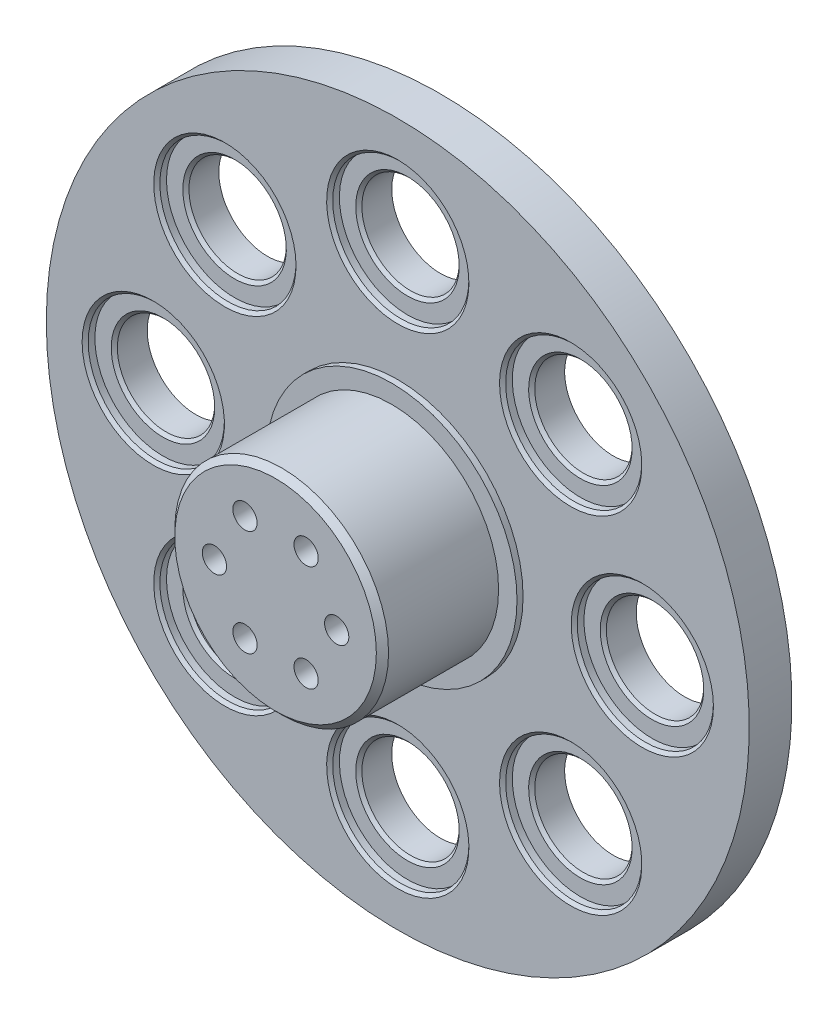
from build123d import *

# Parameters (mm, degrees)
SKETCH1_R                    = 17.49
BOSS_EXTRUDE1_DEPTH          = 19
SKETCH7_R                    = 20.5
BOSS_EXTRUDE3_DEPTH          = 0.995
SKETCH3_R                    = 57.5
BOSS_EXTRUDE2_DEPTH          = 6.975
SKETCH4_R                    = 11.015
CUT_EXTRUDE1_DEPTH           = 7
SKETCH5_R                    = 7.5
CUT_EXTRUDE2_DEPTH           = 0.5
SKETCH6_R                    = 1.985
CUT_EXTRUDE3_DEPTH           = 10
CIRPATTERN1_COUNT            = 6
CHAMFER1_SIZE                = 1
SKETCH8_R                    = 7.965
CUT_EXTRUDE4_DEPTH           = 84.7394771
SKETCH9_R                    = 11.1375
CUT_EXTRUDE5_DEPTH           = 1.5875
CHAMFER2_SIZE                = 0.5
CHAMFER3_SIZE                = 0.5
CIRPATTERN2_COUNT            = 8
CHAMFER2_OF_CIRPATTERN2_SIZE = 0.5
CHAMFER3_OF_CIRPATTERN2_SIZE = 0.5


with BuildPart() as part:
    # Sketch1 → Boss-Extrude1 (new body)
    with BuildSketch(Plane.XY):
        Circle(SKETCH1_R)
    extrude(amount=BOSS_EXTRUDE1_DEPTH)

    # Sketch7 → Boss-Extrude3 (add)
    with BuildSketch(Plane(origin=(0, 0, 0), x_dir=(-1, 0, 0), z_dir=(0, 0, -1))):
        Circle(SKETCH7_R)
    extrude(amount=BOSS_EXTRUDE3_DEPTH)

    # Sketch3 → Boss-Extrude2 (add)
    with BuildSketch(Plane(origin=(0, 0, -0.995), x_dir=(-1, 0, 0), z_dir=(0, 0, -1))):
        Circle(SKETCH3_R)
    extrude(amount=BOSS_EXTRUDE2_DEPTH)

    # Sketch4 → Cut-Extrude1 (cut)
    with BuildSketch(Plane(origin=(0, 0, -7.97), x_dir=(-1, 0, 0), z_dir=(0, 0, -1))):
        Circle(SKETCH4_R)
    extrude(amount=-CUT_EXTRUDE1_DEPTH, mode=Mode.SUBTRACT)

    # Sketch5 → Cut-Extrude2 (cut)
    with BuildSketch(Plane(origin=(0, 0, -0.97), x_dir=(-1, 0, 0), z_dir=(0, 0, -1))):
        Circle(SKETCH5_R)
    extrude(amount=-CUT_EXTRUDE2_DEPTH, mode=Mode.SUBTRACT)

    # Sketch6 → Cut-Extrude3 (cut)
    with BuildSketch(Plane.XY.offset(19)):
        with Locations((-10, 0)):
            Circle(SKETCH6_R)
    cut_extrude3 = extrude(amount=-CUT_EXTRUDE3_DEPTH, mode=Mode.SUBTRACT)

    # CirPattern1: Cut-Extrude3 ×6 about axis
    cirpattern1_axis = Axis((0, 0, 19), (0, 0, 1))
    for i in range(1, CIRPATTERN1_COUNT):
        add(cut_extrude3.rotate(cirpattern1_axis, i * 360 / CIRPATTERN1_COUNT), mode=Mode.SUBTRACT)

    # Chamfer1
    chamfer1_edges = [part.edges().sort_by_distance(p)[0] for p in [
        (11.015, 0, -7.97),
        (-17.49, 0, 19),
    ]]
    chamfer(chamfer1_edges, length=CHAMFER1_SIZE)

    # Sketch8 → Cut-Extrude4 (cut, through all)
    with BuildSketch(Plane.XY.offset(-0.995)):
        with Locations((-40, 0)):
            Circle(SKETCH8_R)
    cut_extrude4 = extrude(amount=-CUT_EXTRUDE4_DEPTH, mode=Mode.SUBTRACT)

    # Sketch9 → Cut-Extrude5 (cut)
    with BuildSketch(Plane.XY.offset(-0.995)):
        with Locations((-40, 0)):
            Circle(SKETCH9_R)
    cut_extrude5 = extrude(amount=-CUT_EXTRUDE5_DEPTH, mode=Mode.SUBTRACT)

    # Chamfer2
    chamfer2_edges = [part.edges().sort_by_distance(p)[0] for p in [
        (-47.965, 0, -2.5825),
    ]]
    chamfer(chamfer2_edges, length=CHAMFER2_SIZE)

    # Chamfer3
    chamfer3_edges = [part.edges().sort_by_distance(p)[0] for p in [
        (-51.1375, 0, -0.995),
    ]]
    chamfer(chamfer3_edges, length=CHAMFER3_SIZE)

    # CirPattern2: Cut-Extrude4, Cut-Extrude5 ×8 about axis
    cirpattern2_axis = Axis((0, 0, -0.995), (0, 0, -1))
    add([cut_extrude4.rotate(cirpattern2_axis, i * 360 / CIRPATTERN2_COUNT) for i in range(1, CIRPATTERN2_COUNT)], mode=Mode.SUBTRACT)
    add([cut_extrude5.rotate(cirpattern2_axis, i * 360 / CIRPATTERN2_COUNT) for i in range(1, CIRPATTERN2_COUNT)], mode=Mode.SUBTRACT)

    # Chamfer2 of CirPattern2
    chamfer2_of_cirpattern2_edges = [part.edges().sort_by_distance(p)[0] for p in [
        (-33.91637676, 33.91637676, -2.5825),
        (0, 47.965, -2.5825),
        (33.91637676, 33.91637676, -2.5825),
        (47.965, 0, -2.5825),
        (33.91637676, -33.91637676, -2.5825),
        (0, -47.965, -2.5825),
        (-33.91637676, -33.91637676, -2.5825),
    ]]
    chamfer(chamfer2_of_cirpattern2_edges, length=CHAMFER2_OF_CIRPATTERN2_SIZE)

    # Chamfer3 of CirPattern2
    chamfer3_of_cirpattern2_edges = [part.edges().sort_by_distance(p)[0] for p in [
        (-36.159673023, 36.159673023, -0.995),
        (0, 51.1375, -0.995),
        (36.159673023, 36.159673023, -0.995),
        (51.1375, 0, -0.995),
        (36.159673023, -36.159673023, -0.995),
        (0, -51.1375, -0.995),
        (-36.159673023, -36.159673023, -0.995),
    ]]
    chamfer(chamfer3_of_cirpattern2_edges, length=CHAMFER3_OF_CIRPATTERN2_SIZE)


solid = part.part
